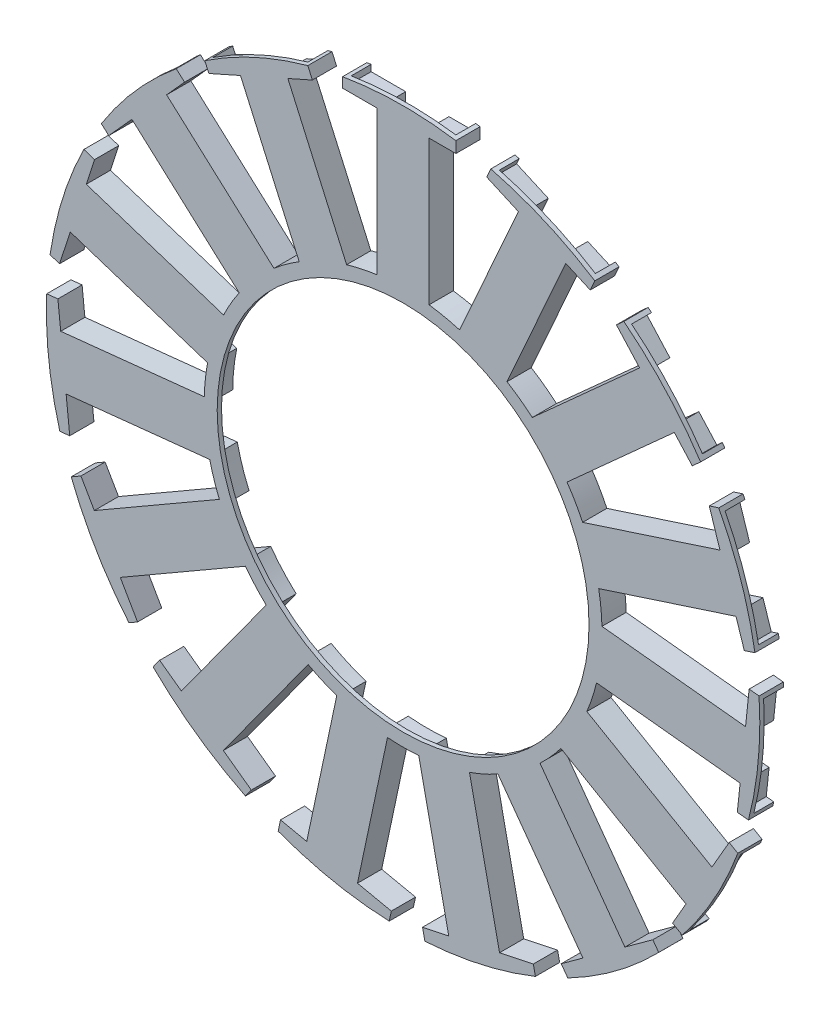
from build123d import *

# Parameters (mm, degrees)
EXTRUDE_2_DEPTH          = 2.3
PATTERN_CIRCULAR_2_COUNT = 15
SKETCH_3_R               = 3.25
CUT_EXTRUDE_2_DEPTH      = 3.2
SKETCH_5_R               = 1.6
CUT_EXTRUDE_3_DEPTH      = 10
SKETCH_6_R               = 1.6
CUT_EXTRUDE_4_DEPTH      = 10
SHELL_2_T                = 0.5
CUT_EXTRUDE_6_DEPTH      = 10
CUT_EXTRUDE_6_DEPTH_BACK = 10
SKETCH_8_R               = 21.5
CUT_EXTRUDE_7_DEPTH      = 10
CUT_EXTRUDE_7_DEPTH_BACK = 10
SKETCH_9_R               = 60.032442796
SKETCH_9_R_2             = 41.25


with BuildPart() as part:
    # ｽｹｯﾁ1 → ﾎﾞｽ - 押し出し2 (new body)
    with BuildSketch(Plane.XY):
        with BuildLine():
            Line((2.5, 22.360679775), (2.5, 40))
            Line((2.5, 40), (5.6, 40))
            Line((5.6, 40), (5.6, 43.64218143))
            ThreePointArc((5.6, 43.64218143), (-0.454315658, 43.997654452), (-6.5, 43.517237964))
            Line((-6.5, 43.517237964), (-6.5, 40))
            Line((-6.5, 40), (-2.5, 40))
            Line((-2.5, 40), (-2.5, 22.360679775))
            ThreePointArc((-2.5, 22.360679775), (0, -22.5), (2.5, 22.360679775))
        make_face()
    extrude_2 = extrude(amount=EXTRUDE_2_DEPTH)

    # 円形ﾊﾟﾀｰﾝ2: ﾎﾞｽ - 押し出し2 ×15 about axis
    pattern_circular_2_axis = Axis((0, 0, 2.3), (0, 0, 1))
    for i in range(1, PATTERN_CIRCULAR_2_COUNT):
        add(extrude_2.rotate(pattern_circular_2_axis, i * 360 / PATTERN_CIRCULAR_2_COUNT))

    # ｽｹｯﾁ3 → ｶｯﾄ - 押し出し2 (cut)
    with BuildSketch(Plane.XY.offset(2.3)):
        Circle(SKETCH_3_R)
    extrude(amount=-CUT_EXTRUDE_2_DEPTH, mode=Mode.SUBTRACT)

    # ｽｹｯﾁ5 → ｶｯﾄ - 押し出し3 (cut)
    with BuildSketch(Plane.XY.offset(2.3)):
        with Locations((-15, 0)):
            Circle(SKETCH_5_R)
        with Locations((15, 0)):
            Circle(SKETCH_5_R)
        with Locations((10.4775, -15.75)):
            Circle(SKETCH_5_R)
        with Locations((-10.4775, -15.75)):
            Circle(SKETCH_5_R)
    extrude(amount=-CUT_EXTRUDE_3_DEPTH, mode=Mode.SUBTRACT)

    # ｽｹｯﾁ6 → ｶｯﾄ - 押し出し4 (cut)
    with BuildSketch(Plane.XY.offset(2.3)):
        with Locations((-16.6, 8)):
            Circle(SKETCH_6_R)
        with Locations((-18.1, -8)):
            Circle(SKETCH_6_R)
        with Locations((18.1, -8)):
            Circle(SKETCH_6_R)
        with Locations((16.6, 8)):
            Circle(SKETCH_6_R)
    extrude(amount=-CUT_EXTRUDE_4_DEPTH, mode=Mode.SUBTRACT)

    # ｼｪﾙ2
    shell_2_openings = [part.faces().sort_by_distance(p)[0] for p in [
        (-4.419386248, 20.79157761, 0),
    ]]
    offset(amount=SHELL_2_T, openings=shell_2_openings, kind=Kind.INTERSECTION)

    # ｽｹｯﾁ8 → ｶｯﾄ - 押し出し6 (cut, two sides: drawn at the far end of the back side and taken through both)
    with BuildSketch(Plane(origin=(0, 0, 2.3), x_dir=(-1, 0, 0), z_dir=(0, 0, -1)).offset(-CUT_EXTRUDE_6_DEPTH_BACK)):
        Circle(SKETCH_8_R)
    extrude(amount=CUT_EXTRUDE_6_DEPTH + CUT_EXTRUDE_6_DEPTH_BACK, mode=Mode.SUBTRACT)

    # ｽｹｯﾁ9 → ｶｯﾄ - 押し出し7 (cut, two sides: drawn at the far end of the back side and taken through both)
    with BuildSketch(Plane(origin=(0, 0, 2.3), x_dir=(-1, 0, 0), z_dir=(0, 0, -1)).offset(-CUT_EXTRUDE_7_DEPTH_BACK)):
        Circle(SKETCH_9_R)
        Circle(SKETCH_9_R_2, mode=Mode.SUBTRACT)
    extrude(amount=CUT_EXTRUDE_7_DEPTH + CUT_EXTRUDE_7_DEPTH_BACK, mode=Mode.SUBTRACT)


solid = part.part
